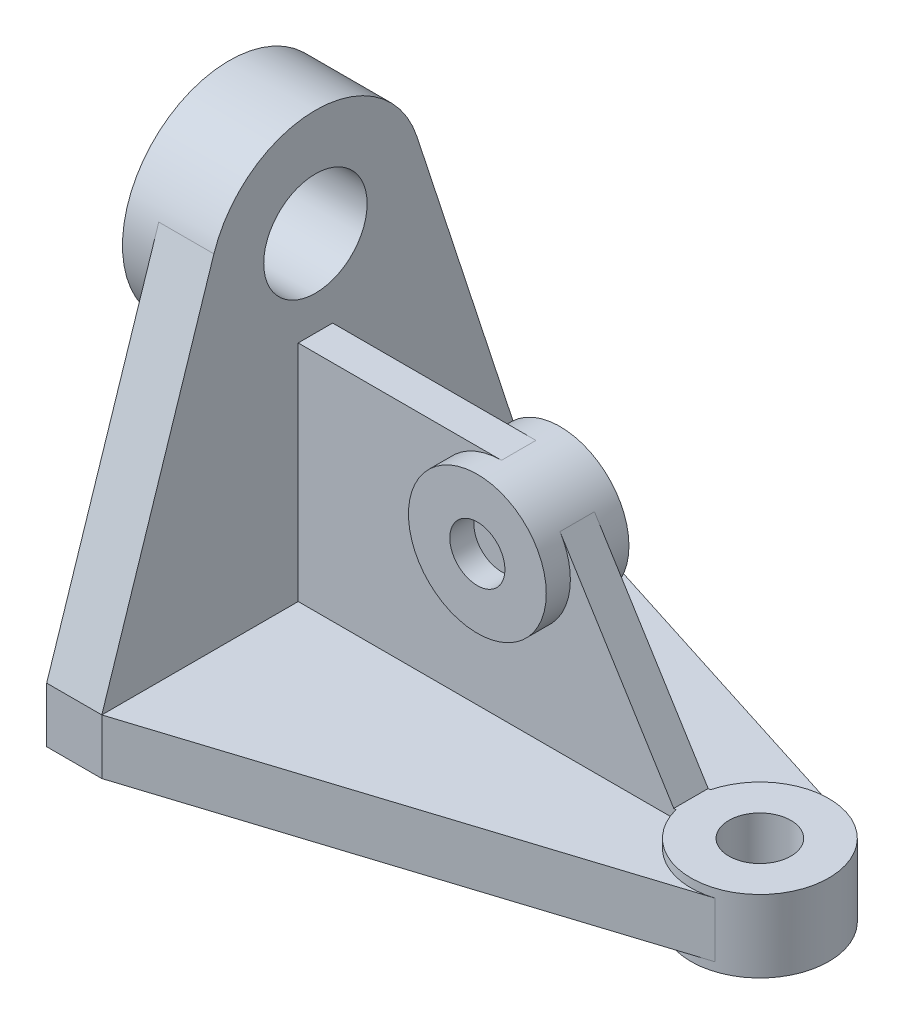
from build123d import *
from build123d.topology import SkipClean

# Parameters (mm, degrees)
SKETCH1_R                = 9
BOSS_EXTRUDE1_DEPTH      = 16
BOSS_EXTRUDE2_DEPTH      = 2.5
BOSS_EXTRUDE2_DEPTH_BACK = 18.5
SKETCH2_R                = 20
SKETCH2_R_2              = 9
SKETCH3_R                = 15
BOSS_EXTRUDE3_DEPTH      = 16
SKETCH5_R                = 31
SKETCH5_R_2              = 15
BOSS_EXTRUDE4_DEPTH      = 25
SKETCH6_R                = 20
SKETCH6_R_2              = 8
BOSS_EXTRUDE5_DEPTH      = 12
BOSS_EXTRUDE6_DEPTH      = 5


with BuildPart() as part:
    # Sketch1 → Boss-Extrude1 (new body)
    with BuildSketch(Plane(origin=(0, 0, 0), x_dir=(1, 0, 0), z_dir=(0, 1, 0))):
        with BuildLine():
            Line((0, 62), (0, -62))
            Line((0, -62), (135.059786766, -19.059878917))
            ThreePointArc((135.059786766, -19.059878917), (149, 0), (135.059786766, 19.059878917))
            Line((135.059786766, 19.059878917), (0, 62))
        make_face()
        with Locations((129, 0)):
            Circle(SKETCH1_R, mode=Mode.SUBTRACT)
    extrude(amount=BOSS_EXTRUDE1_DEPTH)

    # Sketch2 → Boss-Extrude2 (add, two sides: drawn at the far end of the back side and taken through both)
    with SkipClean():  # the faces are left unmerged after this step: merging them gives an invalid solid
        with BuildSketch(Plane(origin=(0, 16, 0), x_dir=(1, 0, 0), z_dir=(0, 1, 0)).offset(-BOSS_EXTRUDE2_DEPTH_BACK)):
            with Locations((129, 0)):
                Circle(SKETCH2_R)
            with Locations((129, 0)):
                Circle(SKETCH2_R_2, mode=Mode.SUBTRACT)
        extrude(amount=BOSS_EXTRUDE2_DEPTH + BOSS_EXTRUDE2_DEPTH_BACK)
    add(part.part.scale(1), mode=Mode.REPLACE)  # the faces are merged on a copy

    # Sketch3 → Boss-Extrude3 (add)
    with BuildSketch(Plane.ZY):
        with BuildLine():
            Line((-62, 0), (62, 0))
            Line((62, 0), (62, 16))
            Line((62, 16), (29.468642629, 115.6228427))
            ThreePointArc((29.468642629, 115.6228427), (0, 137), (-29.468642629, 115.6228427))
            Line((-29.468642629, 115.6228427), (-62, 16))
            Line((-62, 16), (-62, 0))
        make_face()
        with Locations((0, 106)):
            Circle(SKETCH3_R, mode=Mode.SUBTRACT)
    extrude(amount=BOSS_EXTRUDE3_DEPTH)

    # Sketch5 → Boss-Extrude4 (add)
    with SkipClean():  # the faces are left unmerged after this step: merging them gives an invalid solid
        with BuildSketch(Plane(origin=(0, 0, 0), x_dir=(0, 0, -1), z_dir=(1, 0, 0))):
            with Locations((0, 106)):
                Circle(SKETCH5_R)
            with Locations((0, 106)):
                Circle(SKETCH5_R_2, mode=Mode.SUBTRACT)
        extrude(amount=-BOSS_EXTRUDE4_DEPTH)
    add(part.part.scale(1), mode=Mode.REPLACE)  # the faces are merged on a copy



with BuildPart() as body_2:
    # Sketch6 → Boss-Extrude5 (new, symmetric)
    with BuildSketch(Plane.XY):
        with Locations((59, 61)):
            Circle(SKETCH6_R)
        with Locations((59, 61)):
            Circle(SKETCH6_R_2, mode=Mode.SUBTRACT)
    extrude(amount=BOSS_EXTRUDE5_DEPTH, both=True)


with BuildPart() as part_1:
    add(part.part)

    add(body_2.part)  # Boss-Extrude6 merges body 2
    # Sketch7 → Boss-Extrude6 (add, symmetric)
    with BuildSketch(Plane.XY):
        with BuildLine():
            Line((111, 18.5), (109, 18.5))
            Line((109, 18.5), (75.981132075, 71.566037736))
            ThreePointArc((75.981132075, 71.566037736), (68.712858624, 78.483145522), (59, 81))
            Line((59, 81), (0, 81))
            Line((0, 81), (0, 16))
            Line((0, 16), (111, 16))
            Line((111, 16), (111, 18.5))
        make_face()
    extrude(amount=BOSS_EXTRUDE6_DEPTH, both=True)


solid = part_1.part
